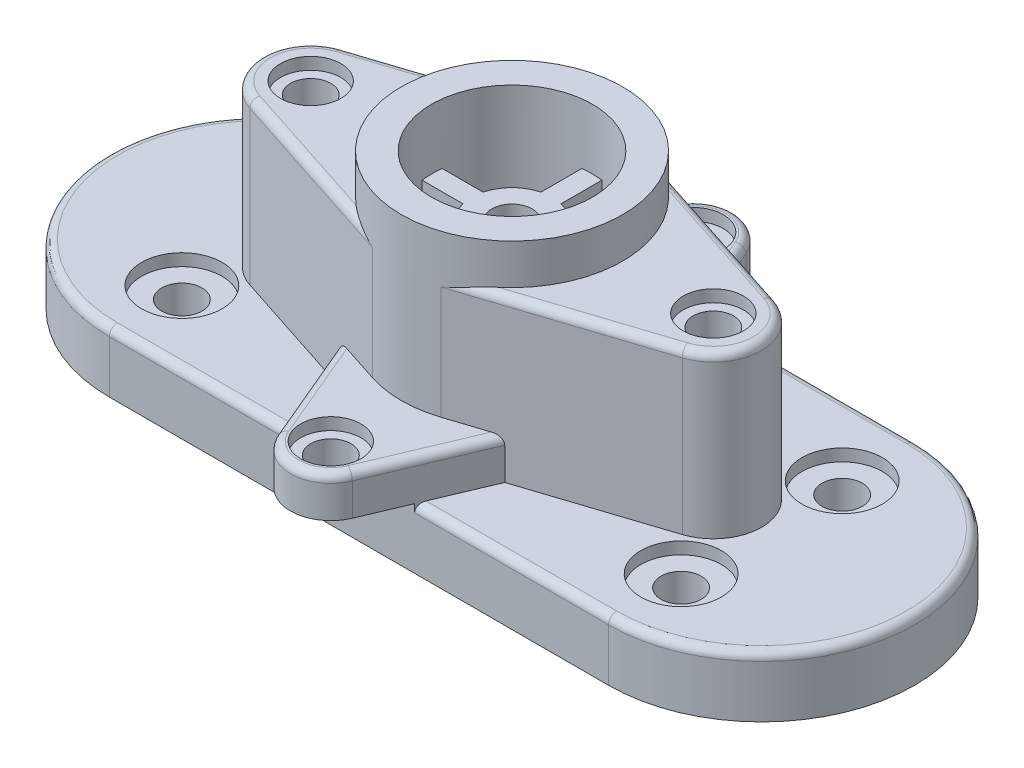
from build123d import *

# Parameters (mm, degrees)
BOSS_EXTRUDE1_DEPTH  = 7.5
SKETCH2_R            = 27.5
BOSS_EXTRUDE2_DEPTH  = 50
HOLE2_D              = 10
HOLE2_DEPTH          = 65
HOLE2_CBORE_D        = 40
HOLE2_CBORE_DEPTH    = 15
HOLE2_TIP            = 3.004303095
BOSS_EXTRUDE3_DEPTH  = 40
HOLE3_D              = 10
HOLE3_DEPTH          = 55
HOLE3_CBORE_D        = 15
HOLE3_CBORE_DEPTH    = 3
HOLE3_TIP            = 3.004303095
BOSS_EXTRUDE4_DEPTH  = 10
HOLE4_D              = 10
HOLE4_DEPTH          = 25
HOLE4_CBORE_D        = 15
HOLE4_CBORE_DEPTH    = 3
HOLE4_TIP            = 3.004303095
HOLE5_D              = 45
HOLE5_DEPTH          = 30
CUT_EXTRUDE1_DEPTH   = 125.599357944
MIRROR4_COPY_1_DEPTH = 125.599357944
FILLET1_R            = 2


with BuildPart() as part:
    # Sketch1 → Boss-Extrude1 (new, symmetric)
    with BuildSketch(Plane(origin=(0, 0, 0), x_dir=(1, 0, 0), z_dir=(0, 1, 0))):
        with BuildLine():
            Line((-62, 38), (62, 38))
            ThreePointArc((62, 38), (100, 0), (62, -38))
            Line((62, -38), (-62, -38))
            ThreePointArc((-62, -38), (-100, 0), (-62, 38))
        make_face()
    extrude(amount=BOSS_EXTRUDE1_DEPTH, both=True)

    # Sketch2 → Boss-Extrude2 (add)
    with BuildSketch(Plane(origin=(0, 7.5, 0), x_dir=(1, 0, 0), z_dir=(0, 1, 0))):
        with Locations(Location((0, 0, 0), (0, 0, 270))):
            Circle(SKETCH2_R)
    extrude(amount=BOSS_EXTRUDE2_DEPTH)

    # Sketch4 → Hole1 (revolve, cut)
    with BuildSketch(Plane(origin=(62, 7.5, -20), x_dir=(0, 0, 1), z_dir=(1, 0, 0))):
        Polygon((0, 0), (0, 18.004303095), (5, 15), (5, 3), (10, 3), (10, 0), align=None)
    hole1 = revolve(axis=Axis((62, 18.810875039, -20), (0, -1, 0)), mode=Mode.SUBTRACT)

    # Mirror1: Hole1 across plane
    add(hole1.mirror(Plane.XY), mode=Mode.SUBTRACT)

    # Mirror2: Hole1 across plane
    add(hole1.mirror(Plane(origin=(0, 0, 0), x_dir=(0, 0, 1), z_dir=(1, 0, 0))), mode=Mode.SUBTRACT)

    # Mirror2 copy 1 sketch → Mirror2 copy 1 (revolve, cut)
    with BuildSketch(Plane(origin=(-62, 7.5, 20), x_dir=(0, 0, -1), z_dir=(-1, 0, 0))):
        Polygon((0, 0), (0, 18.004303095), (5, 15), (5, 3), (10, 3), (10, 0), align=None)
    revolve(axis=Axis((-62, 18.810875039, 20), (0, -1, 0)), mode=Mode.SUBTRACT)

    # Hole2
    with Locations(Plane(origin=(0, 57.5, 0), x_dir=(1, 0, 0), z_dir=(0, 1, 0))):
        with Locations((0, 0)):
            CounterBoreHole(HOLE2_D / 2, HOLE2_CBORE_D / 2, HOLE2_CBORE_DEPTH, depth=HOLE2_DEPTH)
            with Locations((0, 0, -(HOLE2_DEPTH + HOLE2_TIP / 2))):  # 118° drill point
                Cone(0, HOLE2_D / 2, HOLE2_TIP, mode=Mode.SUBTRACT)

    # Sketch7 → Boss-Extrude3 (add)
    with BuildSketch(Plane(origin=(0, 7.5, 0), x_dir=(1, 0, 0), z_dir=(0, 1, 0))):
        with BuildLine():
            Line((-53.72, 11.408838679), (-8.525, 26.145255306))
            ThreePointArc((-8.525, 26.145255306), (-27.5, 0), (-8.525, -26.145255306))
            Line((-8.525, -26.145255306), (-53.72, -11.408838679))
            ThreePointArc((-53.72, -11.408838679), (-62, 0), (-53.72, 11.408838679))
        make_face()
        with BuildLine():
            Line((53.72, 11.408838679), (8.525, 26.145255306))
            ThreePointArc((8.525, 26.145255306), (27.5, 0), (8.525, -26.145255306))
            Line((8.525, -26.145255306), (53.72, -11.408838679))
            ThreePointArc((53.72, -11.408838679), (62, 0), (53.72, 11.408838679))
        make_face()
    extrude(amount=BOSS_EXTRUDE3_DEPTH)

    # Hole3
    with Locations(Plane(origin=(0, 47.5, 0), x_dir=(1, 0, 0), z_dir=(0, 1, 0))):
        with Locations((50, 0), (-50, 0)):
            CounterBoreHole(HOLE3_D / 2, HOLE3_CBORE_D / 2, HOLE3_CBORE_DEPTH, depth=HOLE3_DEPTH)
            with Locations((0, 0, -(HOLE3_DEPTH + HOLE3_TIP / 2))):  # 118° drill point
                Cone(0, HOLE3_D / 2, HOLE3_TIP, mode=Mode.SUBTRACT)

    # Sketch10 → Boss-Extrude4 (add)
    with BuildSketch(Plane(origin=(0, 7.5, 0), x_dir=(1, 0, 0), z_dir=(0, 1, 0))):
        with BuildLine():
            Line((-25.33532826, 10.694444444), (-9.21284664, 48.888888889))
            ThreePointArc((-9.21284664, 48.888888889), (0, 55), (9.21284664, 48.888888889))
            Line((9.21284664, 48.888888889), (25.33532826, 10.694444444))
            ThreePointArc((25.33532826, 10.694444444), (0, 27.5), (-25.33532826, 10.694444444))
        make_face()
        with BuildLine():
            Line((-25.33532826, -10.694444444), (-9.21284664, -48.888888889))
            ThreePointArc((-9.21284664, -48.888888889), (0, -55), (9.21284664, -48.888888889))
            Line((9.21284664, -48.888888889), (25.33532826, -10.694444444))
            ThreePointArc((25.33532826, -10.694444444), (0, -27.5), (-25.33532826, -10.694444444))
        make_face()
    extrude(amount=BOSS_EXTRUDE4_DEPTH)

    # Hole4
    with Locations(Plane(origin=(0, 17.5, 0), x_dir=(1, 0, 0), z_dir=(0, 1, 0))):
        with Locations((0, -45), (0, 45)):
            CounterBoreHole(HOLE4_D / 2, HOLE4_CBORE_D / 2, HOLE4_CBORE_DEPTH, depth=HOLE4_DEPTH)
            with Locations((0, 0, -(HOLE4_DEPTH + HOLE4_TIP / 2))):  # 118° drill point
                Cone(0, HOLE4_D / 2, HOLE4_TIP, mode=Mode.SUBTRACT)

    # Hole5
    with Locations(Plane(origin=(0, -7.5, 0), x_dir=(-1, 0, 0), z_dir=(0, -1, 0))):
        with Locations((0, 0)):
            Hole(HOLE5_D / 2, depth=HOLE5_DEPTH)

    # Sketch16 → Cut-Extrude1 (cut, through all)
    with BuildSketch(Plane(origin=(0, 42.5, 0), x_dir=(1, 0, 0), z_dir=(0, 1, 0))):
        with BuildLine():
            Line((-2.5, 19.843134833), (-2.5, 9.682458366))
            ThreePointArc((-2.5, 9.682458366), (-7.071067812, 7.071067812), (-9.682458366, 2.5))
            Line((-9.682458366, 2.5), (-19.843134833, 2.5))
            ThreePointArc((-19.843134833, 2.5), (-14.142135624, 14.142135624), (-2.5, 19.843134833))
        make_face()
    cut_extrude1 = extrude(amount=-CUT_EXTRUDE1_DEPTH, mode=Mode.SUBTRACT)

    # Mirror3: Cut-Extrude1 across plane
    add(cut_extrude1.mirror(Plane(origin=(0, 0, 0), x_dir=(0, 0, 1), z_dir=(1, 0, 0))), mode=Mode.SUBTRACT)

    # Mirror4: Cut-Extrude1 across plane
    add(cut_extrude1.mirror(Plane.XY), mode=Mode.SUBTRACT)

    # Mirror4 copy 1 sketch → Mirror4 copy 1 (cut, through all)
    with BuildSketch(Plane(origin=(0, 42.5, 0), x_dir=(-1, 0, 0), z_dir=(0, 1, 0))):
        with BuildLine():
            Line((-2.5, 19.843134833), (-2.5, 9.682458366))
            ThreePointArc((-2.5, 9.682458366), (-7.071067812, 7.071067812), (-9.682458366, 2.5))
            Line((-9.682458366, 2.5), (-19.843134833, 2.5))
            ThreePointArc((-19.843134833, 2.5), (-14.142135624, 14.142135624), (-2.5, 19.843134833))
        make_face()
    extrude(amount=-MIRROR4_COPY_1_DEPTH, mode=Mode.SUBTRACT)

    # Fillet1
    # the kernel refuses this fillet: 2 mm, written as the material it takes off along each edge
    with BuildSketch(Plane(origin=(-62, 7.5, -38), x_dir=(0, 0, 1), z_dir=(1, 0, 0))) as fillet1_piece_1_section:
        with BuildLine():
            CenterArc((FILLET1_R, FILLET1_R), FILLET1_R, 180, 90)
            Line((0, FILLET1_R), (0, 0))
            Line((0, 0), (FILLET1_R, 0))
        make_face()
    fillet1_piece_1 = extrude(amount=53.190780418, mode=Mode.PRIVATE)
    fillet1_piece_1 = split(fillet1_piece_1, bisect_by=Plane(origin=(-20.833780662, 7.164754095, -21.358690415), z_dir=(-0.9212846639876113, 0, -0.3888888888888888)), keep=Keep.TOP, mode=Mode.PRIVATE)
    add(fillet1_piece_1, mode=Mode.SUBTRACT)
    with BuildSketch(Plane(origin=(62, 7.5, 38), x_dir=(0, -1, 0), z_dir=(-1, 0, 0))) as fillet1_piece_2_section:
        with BuildLine():
            CenterArc((FILLET1_R, -FILLET1_R), FILLET1_R, 90, 90)
            Line((0, -FILLET1_R), (0, 0))
            Line((0, 0), (FILLET1_R, 0))
        make_face()
    fillet1_piece_2 = extrude(amount=53.190780418, mode=Mode.PRIVATE)
    fillet1_piece_2 = split(fillet1_piece_2, bisect_by=Plane(origin=(17.234551634, 7.038799098, 29.885327715), z_dir=(0.9212846639876113, 0, 0.3888888888888888)), keep=Keep.TOP, mode=Mode.PRIVATE)
    add(fillet1_piece_2, mode=Mode.SUBTRACT)
    with BuildSketch(Plane(origin=(9.21284664, 17.5, -48.888888889), x_dir=(0, -1, 0), z_dir=(0.38888888888888873, 0, 0.9212846639876112))) as fillet1_piece_3_section:
        with BuildLine():
            CenterArc((FILLET1_R, -FILLET1_R), FILLET1_R, 90, 90)
            Line((0, -FILLET1_R), (0, 0))
            Line((0, 0), (FILLET1_R, 0))
        make_face()
    fillet1_piece_3 = extrude(amount=33.909281247, mode=Mode.PRIVATE)
    fillet1_piece_3 = split(fillet1_piece_3, bisect_by=Plane(origin=(11.833338514, 17.039199737, -25.066528573), z_dir=(0.31000000000000016, 0, -0.9507365565707464)), keep=Keep.TOP, mode=Mode.PRIVATE)
    add(fillet1_piece_3, mode=Mode.SUBTRACT)
    with BuildSketch(Plane(origin=(0, 17.5, -45), x_dir=(-0.9212846639876112, 0, -0.38888888888888873), z_dir=(-0.38888888888888873, 0, 0.9212846639876112))) as fillet1_piece_4:
        with BuildLine():
            CenterArc((10 - FILLET1_R, FILLET1_R), FILLET1_R, 270, 90)
            Line((10, FILLET1_R), (10, 0))
            Line((10, 0), (10 - FILLET1_R, 0))
        make_face()
    revolve(axis=Axis((0, 17.5, -45), (0, -1, 0)), revolution_arc=134.229239048, mode=Mode.SUBTRACT)
    with BuildSketch(Plane(origin=(-22.399789347, 17.5, -17.64878811), x_dir=(0, -1, 0), z_dir=(0.38888888888888873, 0, -0.9212846639876112))) as fillet1_piece_5_section:
        with BuildLine():
            CenterArc((FILLET1_R, -FILLET1_R), FILLET1_R, 90, 90)
            Line((0, -FILLET1_R), (0, 0))
            Line((0, 0), (FILLET1_R, 0))
        make_face()
    fillet1_piece_5 = extrude(amount=33.909281247, mode=Mode.PRIVATE)
    fillet1_piece_5 = split(fillet1_piece_5, bisect_by=Plane(origin=(-11.83332722, 17.039199529, -25.066532256), z_dir=(-0.31000000000000016, 0, -0.9507365565707464)), keep=Keep.TOP, mode=Mode.PRIVATE)
    add(fillet1_piece_5, mode=Mode.SUBTRACT)
    with BuildSketch(Plane(origin=(62, 7.5, 0), x_dir=(0, 0, -1), z_dir=(-1, 0, 0))) as fillet1_piece_6:
        with BuildLine():
            CenterArc((38 - FILLET1_R, FILLET1_R), FILLET1_R, 270, 90)
            Line((38 - FILLET1_R, 0), (38, 0))
            Line((38, 0), (38, FILLET1_R))
        make_face()
    revolve(axis=Axis((62, 7.5, 0), (0, -1, 0)), revolution_arc=180, mode=Mode.SUBTRACT)
    with BuildSketch(Plane(origin=(-22.399789347, 17.5, 17.64878811), x_dir=(0, -1, 0), z_dir=(0.38888888888888873, 0, 0.9212846639876112))) as fillet1_piece_7_section:
        with BuildLine():
            CenterArc((FILLET1_R, FILLET1_R), FILLET1_R, 180, 90)
            Line((0, FILLET1_R), (0, 0))
            Line((0, 0), (FILLET1_R, 0))
        make_face()
    fillet1_piece_7 = extrude(amount=33.909281247, mode=Mode.PRIVATE)
    fillet1_piece_7 = split(fillet1_piece_7, bisect_by=Plane(origin=(-11.833330705, 17.039199751, 25.066531119), z_dir=(-0.31000000000000016, 0, 0.9507365565707464)), keep=Keep.TOP, mode=Mode.PRIVATE)
    add(fillet1_piece_7, mode=Mode.SUBTRACT)
    with BuildSketch(Plane(origin=(0, 17.5, 45), x_dir=(-0.9212846639876112, 0, 0.38888888888888873), z_dir=(-0.38888888888888873, 0, -0.9212846639876112))) as fillet1_piece_8:
        with BuildLine():
            CenterArc((10 - FILLET1_R, -FILLET1_R), FILLET1_R, 0, 90)
            Line((10 - FILLET1_R, 0), (10, 0))
            Line((10, 0), (10, -FILLET1_R))
        make_face()
    revolve(axis=Axis((0, 17.5, 45), (0, 1, 0)), revolution_arc=134.229239048, mode=Mode.SUBTRACT)
    with BuildSketch(Plane(origin=(9.21284664, 17.5, 48.888888889), x_dir=(0, -1, 0), z_dir=(0.38888888888888873, 0, -0.9212846639876112))) as fillet1_piece_9_section:
        with BuildLine():
            CenterArc((FILLET1_R, FILLET1_R), FILLET1_R, 180, 90)
            Line((0, FILLET1_R), (0, 0))
            Line((0, 0), (FILLET1_R, 0))
        make_face()
    fillet1_piece_9 = extrude(amount=33.909281247, mode=Mode.PRIVATE)
    fillet1_piece_9 = split(fillet1_piece_9, bisect_by=Plane(origin=(11.833338514, 17.039199737, 25.066528573), z_dir=(0.31000000000000016, 0, 0.9507365565707464)), keep=Keep.TOP, mode=Mode.PRIVATE)
    add(fillet1_piece_9, mode=Mode.SUBTRACT)
    with BuildSketch(Plane(origin=(8.809219582, 7.5, -38), x_dir=(0, 0, 1), z_dir=(1, 0, 0))) as fillet1_piece_10_section:
        with BuildLine():
            CenterArc((FILLET1_R, FILLET1_R), FILLET1_R, 180, 90)
            Line((0, FILLET1_R), (0, 0))
            Line((0, 0), (FILLET1_R, 0))
        make_face()
    fillet1_piece_10 = extrude(amount=53.190780418, mode=Mode.PRIVATE)
    fillet1_piece_10 = split(fillet1_piece_10, bisect_by=Plane(origin=(17.234551178, 7.038799181, -29.885328793), z_dir=(0.9212846639876113, 0, -0.3888888888888888)), keep=Keep.TOP, mode=Mode.PRIVATE)
    add(fillet1_piece_10, mode=Mode.SUBTRACT)
    with BuildSketch(Plane(origin=(-62, 7.5, 0), x_dir=(0, 0, 1), z_dir=(1, 0, 0))) as fillet1_piece_11:
        with BuildLine():
            CenterArc((38 - FILLET1_R, FILLET1_R), FILLET1_R, 270, 90)
            Line((38 - FILLET1_R, 0), (38, 0))
            Line((38, 0), (38, FILLET1_R))
        make_face()
    revolve(axis=Axis((-62, 7.5, 0), (0, -1, 0)), revolution_arc=180, mode=Mode.SUBTRACT)
    with BuildSketch(Plane(origin=(-50, 47.5, 0), x_dir=(-0.3100000000000001, 0, 0.9507365565707464), z_dir=(0.9507365565707464, 0, 0.3100000000000001))) as fillet1_piece_12:
        with BuildLine():
            CenterArc((12 - FILLET1_R, FILLET1_R), FILLET1_R, 270, 90)
            Line((12 - FILLET1_R, 0), (12, 0))
            Line((12, 0), (12, FILLET1_R))
        make_face()
    revolve(axis=Axis((-50, 47.5, 0), (0, -1, 0)), revolution_arc=143.881539018, mode=Mode.SUBTRACT)
    with BuildSketch(Plane(origin=(-3.771317217, 47.5, 27.695255306), x_dir=(0, -1, 0), z_dir=(-0.9507365565707464, 0, -0.31000000000000016))) as fillet1_piece_13_section:
        with BuildLine():
            CenterArc((FILLET1_R, -FILLET1_R), FILLET1_R, 90, 90)
            Line((0, -FILLET1_R), (0, 0))
            Line((0, 0), (FILLET1_R, 0))
        make_face()
    fillet1_piece_13 = extrude(amount=52.536827829, mode=Mode.PRIVATE)
    fillet1_piece_13 = fillet1_piece_13 - Plane(origin=(0, 47.03293557, 0), x_dir=(0, 0, 1), z_dir=(0, -1, 0)) * Cylinder(27.5, 114, mode=Mode.PRIVATE)
    add(fillet1_piece_13, mode=Mode.SUBTRACT)
    with BuildSketch(Plane(origin=(-53.72, 47.5, -11.408838679), x_dir=(0, -1, 0), z_dir=(0.9507365565707464, 0, -0.31000000000000016))) as fillet1_piece_14_section:
        with BuildLine():
            CenterArc((FILLET1_R, -FILLET1_R), FILLET1_R, 90, 90)
            Line((0, -FILLET1_R), (0, 0))
            Line((0, 0), (FILLET1_R, 0))
        make_face()
    fillet1_piece_14 = extrude(amount=52.536827829, mode=Mode.PRIVATE)
    fillet1_piece_14 = fillet1_piece_14 - Plane(origin=(0, 47.032952041, 0), x_dir=(0, 0, 1), z_dir=(0, -1, 0)) * Cylinder(27.5, 114, mode=Mode.PRIVATE)
    add(fillet1_piece_14, mode=Mode.SUBTRACT)
    with BuildSketch(Plane(origin=(50, 47.5, 0), x_dir=(0.3100000000000006, 0, 0.9507365565707462), z_dir=(-0.9507365565707462, 0, 0.3100000000000006))) as fillet1_piece_15:
        with BuildLine():
            CenterArc((12 - FILLET1_R, -FILLET1_R), FILLET1_R, 0, 90)
            Line((12 - FILLET1_R, 0), (12, 0))
            Line((12, 0), (12, -FILLET1_R))
        make_face()
    revolve(axis=Axis((50, 47.5, 0), (0, 1, 0)), revolution_arc=143.881539018, mode=Mode.SUBTRACT)
    with BuildSketch(Plane(origin=(53.72, 47.5, -11.408838679), x_dir=(0, -1, 0), z_dir=(-0.9507365565707464, 0, -0.31000000000000016))) as fillet1_piece_16_section:
        with BuildLine():
            CenterArc((FILLET1_R, FILLET1_R), FILLET1_R, 180, 90)
            Line((0, FILLET1_R), (0, 0))
            Line((0, 0), (FILLET1_R, 0))
        make_face()
    fillet1_piece_16 = extrude(amount=52.536827829, mode=Mode.PRIVATE)
    fillet1_piece_16 = fillet1_piece_16 - Plane(origin=(0, 47.032935729, 0), x_dir=(0, 0, 1), z_dir=(0, -1, 0)) * Cylinder(27.5, 114, mode=Mode.PRIVATE)
    add(fillet1_piece_16, mode=Mode.SUBTRACT)
    with BuildSketch(Plane(origin=(3.771317217, 47.5, 27.695255306), x_dir=(0, -1, 0), z_dir=(0.9507365565707464, 0, -0.31000000000000016))) as fillet1_piece_17_section:
        with BuildLine():
            CenterArc((FILLET1_R, FILLET1_R), FILLET1_R, 180, 90)
            Line((0, FILLET1_R), (0, 0))
            Line((0, 0), (FILLET1_R, 0))
        make_face()
    fillet1_piece_17 = extrude(amount=52.536827829, mode=Mode.PRIVATE)
    fillet1_piece_17 = fillet1_piece_17 - Plane(origin=(0, 47.03293558, 0), x_dir=(0, 0, 1), z_dir=(0, -1, 0)) * Cylinder(27.5, 114, mode=Mode.PRIVATE)
    add(fillet1_piece_17, mode=Mode.SUBTRACT)
    with BuildSketch(Plane(origin=(-8.809219582, 7.5, 38), x_dir=(0, -1, 0), z_dir=(-1, 0, 0))) as fillet1_piece_18_section:
        with BuildLine():
            CenterArc((FILLET1_R, -FILLET1_R), FILLET1_R, 90, 90)
            Line((0, -FILLET1_R), (0, 0))
            Line((0, 0), (FILLET1_R, 0))
        make_face()
    fillet1_piece_18 = extrude(amount=53.190780418, mode=Mode.PRIVATE)
    fillet1_piece_18 = split(fillet1_piece_18, bisect_by=Plane(origin=(-17.234549683, 7.038799175, 29.885332337), z_dir=(-0.9212846639876113, 0, 0.3888888888888888)), keep=Keep.TOP, mode=Mode.PRIVATE)
    add(fillet1_piece_18, mode=Mode.SUBTRACT)


solid = part.part
